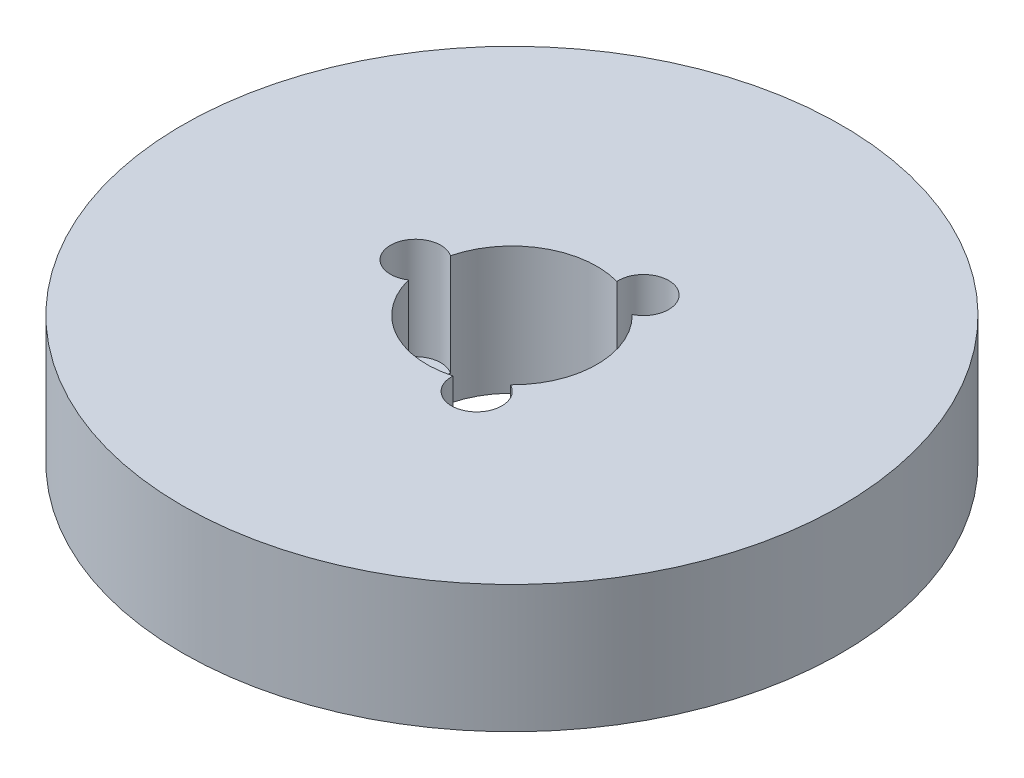
from build123d import *

# Parameters (mm, degrees)
SKETCH1_R           = 77.5
BOSS_EXTRUDE1_DEPTH = 30
SKETCH2_R           = 20
CUT_EXTRUDE1_DEPTH  = 114.633181774
SKETCH3_R           = 5.921381084
CUT_EXTRUDE2_DEPTH  = 23.925019504
CIRPATTERN1_COUNT   = 3


with BuildPart() as part:
    # Sketch1 → Boss-Extrude1 (new body)
    with BuildSketch(Plane(origin=(0, 0, 0), x_dir=(1, 0, 0), z_dir=(0, 1, 0))):
        Circle(SKETCH1_R)
    extrude(amount=BOSS_EXTRUDE1_DEPTH)

    # Sketch2 → Cut-Extrude1 (cut, through all)
    with BuildSketch(Plane(origin=(0, 0, 0), x_dir=(1, 0, 0), z_dir=(0, 1, 0))):
        Circle(SKETCH2_R)
    extrude(amount=CUT_EXTRUDE1_DEPTH, mode=Mode.SUBTRACT)

    # Sketch3 → Cut-Extrude2 (cut)
    with BuildSketch(Plane(origin=(0, 30, 0), x_dir=(1, 0, 0), z_dir=(0, 1, 0))):
        with Locations((-22.653575912, 0)):
            Circle(SKETCH3_R)
    cut_extrude2 = extrude(amount=-CUT_EXTRUDE2_DEPTH, mode=Mode.SUBTRACT)

    # CirPattern1: Cut-Extrude2 ×3 about axis
    cirpattern1_axis = Axis((0, 0, 0), (0, 1, 0))
    for i in range(1, CIRPATTERN1_COUNT):
        add(cut_extrude2.rotate(cirpattern1_axis, i * 360 / CIRPATTERN1_COUNT), mode=Mode.SUBTRACT)


solid = part.part
